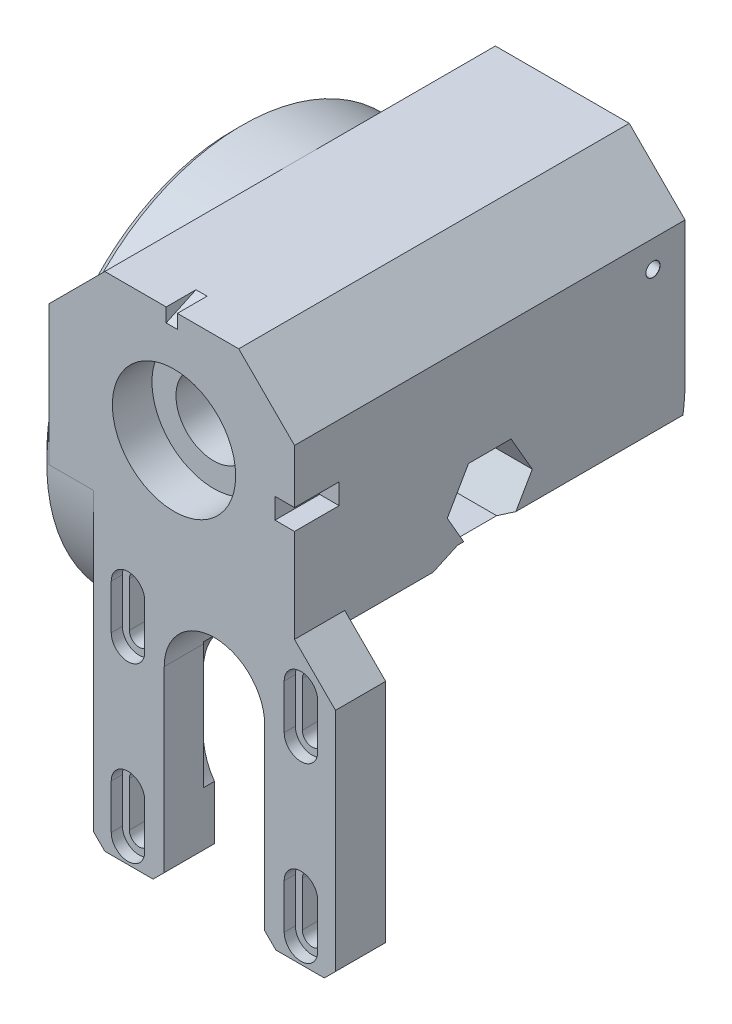
from build123d import *
from OCP.BRepFilletAPI import BRepFilletAPI_MakeChamfer

# Parameters (mm, degrees)
SKETCH1_R               = 35
SKETCH1_R_2             = 4
BOSS_EXTRUDE1_DEPTH     = 2
CHAMFER1_SIZE           = 1.6
SKETCH2_R               = 4
BOSS_EXTRUDE2_DEPTH     = 8
BOSS_EXTRUDE3_OUTLINE_R = 4
BOSS_EXTRUDE3_DEPTH     = 36
SKETCH18_R              = 4
CUT_EXTRUDE9_DEPTH      = 7
SKETCH_4_W              = 36
SKETCH_4_H              = 47
CUT_EXTRUDE_1_DEPTH     = 8
SKETCH_3_W              = 7.337713442
SKETCH_3_H              = 90
EXTRUDE_7_DEPTH         = 9
CUT_EXTRUDE_4_DEPTH     = 98.933200066
CUT_EXTRUDE_5_DEPTH     = 2
CHAMFER_1_SIZE          = 10
CHAMFER_2_SIZE          = 10
CHAMFER_4_SIZE          = 5
CHAMFER_4_SIZE2         = 2.886751346
CUT_EXTRUDE_13_REACH    = 105.778
SKETCH_16_R             = 6.75
CUT_EXTRUDE_15_DEPTH    = 12
CUT_EXTRUDE_21_DEPTH    = 2
SKETCH_39_R             = 11.05
SKETCH_39_R_2           = 6.75
CUT_EXTRUDE_29_DEPTH    = 18
SKETCH_40_W             = 1.391304348
SKETCH_40_H             = 0.391304348
CUT_EXTRUDE_30_DEPTH    = 1
CUT_EXTRUDE_START       = -7.1
SKETCH_12_R             = 11.05
SKETCH_12_R_2           = 4.5
CUT_EXTRUDE_36_DEPTH    = 7.1
CUT_EXTRUDE_37_DEPTH    = 104.778184968
CUT_EXTRUDE_39_DEPTH    = 98.933200066
CHAMFER_5_SIZE          = 2
SKETCH_48_W             = 8
SKETCH_48_H             = 1.85
CUT_EXTRUDE_46_DEPTH    = 3.5
CUT_EXTRUDE_48_DEPTH    = 1


# Read off the part's stored shape, not the designer's step: Boss-Extrude3, M3 螺纹孔的螺纹孔钻头1
with BuildPart() as part:
    # Sketch1 → Boss-Extrude1 (new body)
    with BuildSketch(Plane(origin=(0, 0, 0), x_dir=(0, 0, -1), z_dir=(1, 0, 0))):
        Circle(SKETCH1_R)
        Circle(SKETCH1_R_2, mode=Mode.SUBTRACT)
    extrude(amount=BOSS_EXTRUDE1_DEPTH)

    # Chamfer1
    chamfer1_edges = [part.edges().sort_by_distance(p)[0] for p in [
        (0, 0, 35),
    ]]
    chamfer(chamfer1_edges, length=CHAMFER1_SIZE)

    # Sketch2 → Boss-Extrude2 (add)
    with BuildSketch(Plane(origin=(2, 0, 0), x_dir=(0, 0, -1), z_dir=(1, 0, 0))):
        with BuildLine():
            Line((35, 35), (35, 0))
            ThreePointArc((35, 0), (0, -35), (-35, 0))
            Line((-35, 0), (-35, 35))
            Line((-35, 35), (35, 35))
        make_face()
        Circle(SKETCH2_R, mode=Mode.SUBTRACT)
    extrude(amount=BOSS_EXTRUDE2_DEPTH)

    # Boss-Extrude3 outline → Boss-Extrude3 (add)
    with BuildSketch(Plane(origin=(10, 0, 0), x_dir=(0, 0, -1), z_dir=(1, 0, 0))):
        with BuildLine():
            Line((35, 0), (35, 35))
            Line((35, 35), (-35, 35))
            Line((-35, 35), (-35, -55))
            Line((-35, -55), (-27, -55))
            Line((-27, -55), (-27, -10))
            Line((-27, -10), (-9.537637864, -10))
            Line((-9.537637864, -10), (-5.152968495, -8))
            Line((-5.152968495, -8), (34.073450075, -8))
            ThreePointArc((34.073450075, -8), (34.76759089, -4.026738592), (35, 0))
        make_face()
        Circle(BOSS_EXTRUDE3_OUTLINE_R, mode=Mode.SUBTRACT)
    extrude(amount=BOSS_EXTRUDE3_DEPTH)

    # Sketch18 → Cut-Extrude9 (cut)
    with BuildSketch(Plane.ZY):
        with Locations((14.142135624, 14.142135624)):
            Circle(SKETCH18_R)
        with Locations((14.142135624, -14.142135624)):
            Circle(SKETCH18_R)
        with Locations((-14.142135624, -14.142135624)):
            Circle(SKETCH18_R)
        with Locations((-14.142135624, 14.142135624)):
            Circle(SKETCH18_R)
    extrude(amount=-CUT_EXTRUDE9_DEPTH, mode=Mode.SUBTRACT)

    # 草图4 → 切除-拉伸1 (cut)
    with BuildSketch(Plane(origin=(0, 0, 27), x_dir=(-1, 0, 0), z_dir=(0, 0, -1))):
        with Locations((-28, -31.5)):
            Rectangle(SKETCH_4_W, SKETCH_4_H)
    extrude(amount=-CUT_EXTRUDE_1_DEPTH, mode=Mode.SUBTRACT)

    # 草图3 → 凸台-拉伸7 (add)
    with BuildSketch(Plane.XY.offset(35)):
        with Locations((49.668856721, -10)):
            Rectangle(SKETCH_3_W, SKETCH_3_H)
        Polygon((46, 35), (2, 35), (2, 0), (10, 0), (10, -55), (46, -55), align=None)
    extrude(amount=-EXTRUDE_7_DEPTH)

    # 草图7 → 切除-拉伸4 (cut, through all)
    with BuildSketch(Plane(origin=(0, 0, 26), x_dir=(-1, 0, 0), z_dir=(0, 0, -1))):
        with BuildLine():
            Line((-45.4, -12.5), (-45.4, -20.5))
            ThreePointArc((-45.4, -20.5), (-47.15, -22.25), (-48.9, -20.5))
            Line((-48.9, -20.5), (-48.9, -12.5))
            ThreePointArc((-48.9, -12.5), (-47.15, -10.75), (-45.4, -12.5))
        make_face()
        with BuildLine():
            Line((-14.4, -12.5), (-14.4, -20.5))
            ThreePointArc((-14.4, -20.5), (-16.15, -22.25), (-17.9, -20.5))
            Line((-17.9, -20.5), (-17.9, -12.5))
            ThreePointArc((-17.9, -12.5), (-16.15, -10.75), (-14.4, -12.5))
        make_face()
        with BuildLine():
            Line((-14.4, -43.5), (-14.4, -51.5))
            ThreePointArc((-14.4, -51.5), (-16.15, -53.25), (-17.9, -51.5))
            Line((-17.9, -51.5), (-17.9, -43.5))
            ThreePointArc((-17.9, -43.5), (-16.15, -41.75), (-14.4, -43.5))
        make_face()
        with BuildLine():
            Line((-45.4, -43.5), (-45.4, -51.5))
            ThreePointArc((-45.4, -51.5), (-47.15, -53.25), (-48.9, -51.5))
            Line((-48.9, -51.5), (-48.9, -43.5))
            ThreePointArc((-48.9, -43.5), (-47.15, -41.75), (-45.4, -43.5))
        make_face()
    extrude(amount=-CUT_EXTRUDE_4_DEPTH, mode=Mode.SUBTRACT)

    # 草图8 → 切除-拉伸5 (cut)
    with BuildSketch(Plane.XY.offset(35)):
        with BuildLine():
            Line((19.15, -12.5), (19.15, -20.5))
            ThreePointArc((19.15, -20.5), (16.15, -23.5), (13.15, -20.5))
            Line((13.15, -20.5), (13.15, -12.5))
            ThreePointArc((13.15, -12.5), (16.15, -9.5), (19.15, -12.5))
        make_face()
        with BuildLine():
            Line((50.15, -12.5), (50.15, -20.5))
            ThreePointArc((50.15, -20.5), (47.15, -23.5), (44.15, -20.5))
            Line((44.15, -20.5), (44.15, -12.5))
            ThreePointArc((44.15, -12.5), (47.15, -9.5), (50.15, -12.5))
        make_face()
        with BuildLine():
            Line((50.15, -43.5), (50.15, -51.5))
            ThreePointArc((50.15, -51.5), (47.15, -54.5), (44.15, -51.5))
            Line((44.15, -51.5), (44.15, -43.5))
            ThreePointArc((44.15, -43.5), (47.15, -40.5), (50.15, -43.5))
        make_face()
        with BuildLine():
            Line((19.15, -43.5), (19.15, -51.5))
            ThreePointArc((19.15, -51.5), (16.15, -54.5), (13.15, -51.5))
            Line((13.15, -51.5), (13.15, -43.5))
            ThreePointArc((13.15, -43.5), (16.15, -40.5), (19.15, -43.5))
        make_face()
    extrude(amount=-CUT_EXTRUDE_5_DEPTH, mode=Mode.SUBTRACT)

    # 倒角1
    chamfer_1_edges = [part.edges().sort_by_distance(p)[0] for p in [
        (46, 35, -4.5),
    ]]
    chamfer(chamfer_1_edges, length=CHAMFER_1_SIZE)

    # 倒角2
    # the kernel refuses this chamfer: 10 mm, written as the material it takes off along each edge
    with BuildSketch(Plane(origin=(2, 35, -6.3e-08), x_dir=(-0.02749587661058636, -0.9996219169112968, 0), z_dir=(0, 0, -1))) as chamfer_2_piece_1_section:
        Polygon((CHAMFER_2_SIZE * 0.999621916911, -CHAMFER_2_SIZE * 0.0274958766106), (-CHAMFER_2_SIZE * 0.0274958766106, -CHAMFER_2_SIZE * 0.999621916911), (0, 0), align=None)
    chamfer_2_piece_1 = extrude(amount=60.716829816, mode=Mode.PRIVATE)
    chamfer_2_piece_1 = chamfer_2_piece_1 - Plane(origin=(5.625203786, 0, 0), x_dir=(0, 0, -1), z_dir=(-1, 0, 0)) * Cylinder(35, 162, mode=Mode.PRIVATE)
    add(chamfer_2_piece_1, mode=Mode.SUBTRACT)
    with BuildSketch(Plane(origin=(2, 35, 60.71682988), x_dir=(-0.02749587661058636, -0.9996219169112968, 0), z_dir=(0, 0, -1))) as chamfer_2_piece_2_section:
        Polygon((CHAMFER_2_SIZE * 0.999621916911, -CHAMFER_2_SIZE * 0.0274958766106), (-CHAMFER_2_SIZE * 0.0274958766106, -CHAMFER_2_SIZE * 0.999621916911), (0, 0), align=None)
    chamfer_2_piece_2 = extrude(amount=60.716829943, mode=Mode.PRIVATE)
    chamfer_2_piece_2 = chamfer_2_piece_2 - Plane(origin=(5.625203786, 0, 0), x_dir=(0, 0, -1), z_dir=(-1, 0, 0)) * Cylinder(35, 162, mode=Mode.PRIVATE)
    add(chamfer_2_piece_2, mode=Mode.SUBTRACT)

    # 倒角4: one chamfer whose edges measure the first distance from different faces: ONE call of the kernel's chamfer builder (chamfer() names one face for all edges)
    chamfer_4_edges_1 = [part.edges().sort_by_distance(p)[0] for p in [
        (46, -9, 7.34530318),
    ]]
    chamfer_4_side_1 = [part.faces().sort_by_distance(p)[0] for p in [
        (28, -9, 7.34530318),
    ]]
    chamfer_4_edges_2 = [part.edges().sort_by_distance(p)[0] for p in [
        (46, -8, -14.46024079),
    ]]
    chamfer_4_side_2 = [part.faces().sort_by_distance(p)[0] for p in [
        (28, -8, -14.46024079),
    ]]
    chamfer_4_edges_3 = [part.edges().sort_by_distance(p)[0] for p in [
        (46, -10, 17.768818932),
    ]]
    chamfer_4_side_3 = [part.faces().sort_by_distance(p)[0] for p in [
        (28, -10, 17.768818932),
    ]]
    chamfer_4 = BRepFilletAPI_MakeChamfer(part.part.solid().wrapped)
    for e in chamfer_4_edges_1:
        chamfer_4.Add(CHAMFER_4_SIZE, CHAMFER_4_SIZE2, e.wrapped, chamfer_4_side_1[0].wrapped)  # the first distance lies on this face
    for e in chamfer_4_edges_2:
        chamfer_4.Add(CHAMFER_4_SIZE, CHAMFER_4_SIZE2, e.wrapped, chamfer_4_side_2[0].wrapped)  # the first distance lies on this face
    for e in chamfer_4_edges_3:
        chamfer_4.Add(CHAMFER_4_SIZE, CHAMFER_4_SIZE2, e.wrapped, chamfer_4_side_3[0].wrapped)  # the first distance lies on this face
    add(Compound.cast(chamfer_4.Shape()), mode=Mode.REPLACE)

    # 草图16 → 切除-拉伸13 (cut, up to next)
    with BuildSketch(Plane(origin=(0, 0, -35), x_dir=(-1, 0, 0), z_dir=(0, 0, -1)), mode=Mode.PRIVATE) as cut_extrude_13_sk1:
        with Locations(Location((-24.4, 15, 0), (0, 0, 90))):
            Circle(SKETCH_16_R)
    cut_extrude_13_tool1 = extrude(cut_extrude_13_sk1.sketch, amount=-CUT_EXTRUDE_13_REACH, mode=Mode.PRIVATE) & part.part
    add(cut_extrude_13_tool1.solids().sort_by_distance((24.4, 15, -35))[0], mode=Mode.SUBTRACT)

    # 草图19 → 切除-拉伸15 (cut)
    with BuildSketch(Plane(origin=(46, 0, 0), x_dir=(0, 0, -1), z_dir=(1, 0, 0))):
        Polygon((3.810511777, -6.6), (7.621023553, 0), (3.810511777, 6.6), (-3.810511777, 6.6), (-7.621023553, 0), (-3.810511777, -6.6), align=None)
    extrude(amount=-CUT_EXTRUDE_15_DEPTH, mode=Mode.SUBTRACT)

    # 草图27 → 切除-拉伸21 (cut)
    with BuildSketch(Plane.XY.offset(26)):
        with BuildLine():
            Line((20.65, -37), (20.65, -27))
            ThreePointArc((20.65, -27), (31.65, -16), (42.65, -27))
            Line((42.65, -27), (42.65, -37))
            ThreePointArc((42.65, -37), (31.65, -48), (20.65, -37))
        make_face()
    extrude(amount=CUT_EXTRUDE_21_DEPTH, mode=Mode.SUBTRACT)

    # 草图39 → 切除-拉伸29 (cut)
    with BuildSketch(Plane(origin=(0, 0, -35), x_dir=(-1, 0, 0), z_dir=(0, 0, -1))):
        with Locations(Location((-24.4, 15, 0), (0, 0, 90))):
            Circle(SKETCH_39_R)
        with Locations(Location((-24.4, 15, 0), (0, 0, 90))):
            Circle(SKETCH_39_R_2, mode=Mode.SUBTRACT)
    extrude(amount=-CUT_EXTRUDE_29_DEPTH, mode=Mode.SUBTRACT)

    # 草图40 → 切除-拉伸30 (cut)
    # profile 1 of 11: a face of its own
    with BuildSketch(Plane.XZ.offset(8)):
        Polygon((16.851317631, -15.470025994), (16.406344805, -15.470025994), (16.205257848, -14.817852081), (14.959333935, -14.817852081), (14.753491544, -15.470025994), (14.3295785, -15.470025994), (15.326861109, -12.470025994), (15.88596437, -12.470025994), align=None)
        Polygon((16.09860024, -14.470025994), (15.590448066, -12.819890125), (15.069388283, -14.470025994), align=None, mode=Mode.SUBTRACT)
    # profile 2 of 11: a face of its own
    with BuildSketch(Plane.XZ.offset(8)):
        Polygon((19.394795892, -15.470025994), (18.879170892, -15.470025994), (18.153627413, -14.309699907), (17.425366544, -15.470025994), (16.916535022, -15.470025994), (17.909741544, -13.919074907), (17.003491544, -12.470025994), (17.487187196, -12.470025994), (18.159741544, -13.529129255), (18.837730674, -12.470025994), (19.30783937, -12.470025994), (18.402948066, -13.912281429), align=None)
    # profile 3 of 11: a face of its own
    with BuildSketch(Plane.XZ.offset(8)):
        Polygon((20.525230674, -12.817852081), (19.8295785, -12.817852081), (19.8295785, -12.470025994), (21.655665457, -12.470025994), (21.655665457, -12.817852081), (20.960013283, -12.817852081), (20.960013283, -15.122199907), (21.655665457, -15.122199907), (21.655665457, -15.470025994), (19.8295785, -15.470025994), (19.8295785, -15.122199907), (20.525230674, -15.122199907), align=None)
    # profile 4 of 11: a face of its own
    with BuildSketch(Plane.XZ.offset(8)):
        with BuildLine():
            add(Edge.make_bspline(
                [(24.30783937, -14.658205342), (24.306863056, -14.692918378), (24.304969024, -14.760261083), (24.288304827, -14.858252502), (24.260514205, -14.949271679), (24.222325464, -15.033941656), (24.173198352, -15.110724697), (24.117084071, -15.182391478), (24.05007892, -15.245429885), (23.975848413, -15.3028293), (23.893233107, -15.353344765), (23.802021603, -15.395858147), (23.703464294, -15.43258587), (23.597287356, -15.462199527), (23.484440168, -15.485220142), (23.365479745, -15.501034546), (23.241003768, -15.511708169), (23.156141539, -15.512897674), (23.112866544, -15.513504255)],
                knots=[0, 0, 0, 0, 1.005643061, 1.95093061, 2.870738502, 3.757832008, 4.633806625, 5.507195241, 6.389247641, 7.292512577, 8.223494331, 9.189475669, 10.205094408, 11.269007441, 12.381228937, 13.540657028, 14.745872513, 16, 16, 16, 16], degree=3))
            add(Edge.make_bspline(
                [(23.112866544, -15.513504255), (23.073006042, -15.513057638), (22.993475888, -15.512166543), (22.875208029, -15.506703737), (22.759503923, -15.497679378), (22.648092539, -15.486827646), (22.54181823, -15.474764532), (22.442088904, -15.460813278), (22.350162525, -15.444591247), (22.291959437, -15.432351493), (22.264361109, -15.426547733)],
                knots=[0, 0, 0, 0, 1.119729043, 2.234096861, 3.324996266, 4.379512959, 5.378439906, 6.329323539, 7.207810484, 8, 8, 8, 8], degree=3))
            Line((22.264361109, -15.426547733), (22.264361109, -15.035243385))
            add(Edge.make_bspline(
                [(22.264361109, -15.035243385), (22.293908648, -15.04536727), (22.354281712, -15.066052915), (22.448982488, -15.0903153), (22.548320499, -15.113101429), (22.653239689, -15.132137822), (22.764762226, -15.147120395), (22.883313604, -15.157657457), (23.009292073, -15.16479307), (23.095645905, -15.16537764), (23.140040457, -15.165678168)],
                knots=[0, 0, 0, 0, 0.842364813, 1.72116351, 2.635659137, 3.591954833, 4.596841017, 5.670471508, 6.802388115, 8, 8, 8, 8], degree=3))
            add(Edge.make_bspline(
                [(23.140040457, -15.165678168), (23.171758228, -15.165351663), (23.232765976, -15.164723645), (23.320675035, -15.158157863), (23.40140017, -15.149597744), (23.47476748, -15.134729529), (23.541513295, -15.117616091), (23.601843101, -15.095838646), (23.655661714, -15.06992222), (23.703907991, -15.040868741), (23.745256104, -15.007300048), (23.781507465, -14.971123095), (23.810599296, -14.930765956), (23.83423081, -14.887186379), (23.85170034, -14.840236986), (23.863831835, -14.790041746), (23.871463305, -14.736788927), (23.872516232, -14.700124929), (23.873056761, -14.681303168)],
                knots=[0, 0, 0, 0, 1.523194236, 2.929797672, 4.233142745, 5.41923506, 6.522104548, 7.540643951, 8.494207191, 9.387815665, 10.238903194, 11.04655015, 11.840679357, 12.619387111, 13.4214478, 14.239285369, 15.096122854, 16, 16, 16, 16], degree=3))
            add(Edge.make_bspline(
                [(23.873056761, -14.681303168), (23.872382194, -14.661746383), (23.87106423, -14.623536538), (23.857602133, -14.56871879), (23.836554238, -14.517883978), (23.805696955, -14.472546922), (23.769434308, -14.429948904), (23.72683396, -14.390915573), (23.67980914, -14.353171158), (23.608456303, -14.305705876), (23.508613888, -14.249932271), (23.375612488, -14.194157789), (23.234572648, -14.138156835), (23.089827868, -14.07974756), (22.945119991, -14.017745884), (22.803155865, -13.952061731), (22.670009755, -13.876708371), (22.569748366, -13.801937644), (22.499698524, -13.734609031), (22.452042617, -13.68069959), (22.411151803, -13.621830932), (22.373377868, -13.560085059), (22.343825048, -13.491849179), (22.32332124, -13.417764497), (22.309714193, -13.337821728), (22.308478838, -13.28258572), (22.30783937, -13.253993385)],
                knots=[0, 0, 0, 0, 0.619815692, 1.2109895, 1.781199776, 2.357496674, 2.943929778, 3.554333405, 4.188738872, 4.856760597, 6.272963823, 7.811824644, 9.431291666, 11.092170587, 12.76691914, 14.429617761, 16.056218893, 17.616396577, 18.384212937, 19.138341755, 19.896401647, 20.65718422, 21.4332038, 22.247956952, 23.09307348, 24, 24, 24, 24], degree=3))
            add(Edge.make_bspline(
                [(22.30783937, -13.253993385), (22.308618811, -13.228355328), (22.310179609, -13.177016221), (22.323072766, -13.10030347), (22.343350422, -13.024261003), (22.371898039, -12.949165399), (22.409291803, -12.876754666), (22.454800989, -12.80733491), (22.510700058, -12.74341942), (22.574797876, -12.68315226), (22.648953544, -12.628011981), (22.732240238, -12.577711606), (22.826012929, -12.534544289), (22.92847657, -12.49537107), (23.041696822, -12.464275691), (23.165112334, -12.441998211), (23.298747257, -12.429424954), (23.391146429, -12.427528799), (23.4389535, -12.426547733)],
                knots=[0, 0, 0, 0, 0.784067079, 1.570060577, 2.373452904, 3.189297991, 4.022898002, 4.862695015, 5.722463422, 6.614650011, 7.550049647, 8.544652583, 9.586108202, 10.704431291, 11.897970904, 13.172772987, 14.537200697, 16, 16, 16, 16], degree=3))
            add(Edge.make_bspline(
                [(23.4389535, -12.426547733), (23.46568462, -12.426720922), (23.521238556, -12.427080852), (23.606837457, -12.433234354), (23.696118255, -12.440995092), (23.786902719, -12.452112417), (23.877535523, -12.464804209), (23.966513649, -12.479767691), (24.051928816, -12.495738251), (24.107230394, -12.507720177), (24.133926327, -12.513504255)],
                knots=[0, 0, 0, 0, 0.91416123, 1.89985515, 2.934260182, 3.979599391, 5.027947684, 6.064525625, 7.065681407, 8, 8, 8, 8], degree=3))
            Line((24.133926327, -12.513504255), (24.133926327, -12.861330342))
            add(Edge.make_bspline(
                [(24.133926327, -12.861330342), (24.074505843, -12.848151272), (23.956254233, -12.821923849), (23.778285423, -12.795760711), (23.603509818, -12.777438165), (23.488138107, -12.775383056), (23.431480674, -12.77437382)],
                knots=[0, 0, 0, 0, 1.029411825, 2.048613503, 3.041701399, 4, 4, 4, 4], degree=3))
            add(Edge.make_bspline(
                [(23.431480674, -12.77437382), (23.402940955, -12.774810058), (23.347619797, -12.775655658), (23.267529963, -12.780854671), (23.193372842, -12.790375035), (23.125073091, -12.803251294), (23.06244196, -12.819185855), (23.005672202, -12.839430021), (22.955076577, -12.864140695), (22.909803794, -12.891904699), (22.870518544, -12.923334997), (22.835983581, -12.95670232), (22.807150642, -12.992985651), (22.783876345, -13.032178521), (22.765662349, -13.07375984), (22.751516946, -13.117555729), (22.744337616, -13.164309619), (22.743202518, -13.196228468), (22.742621979, -13.212553168)],
                knots=[0, 0, 0, 0, 1.491437277, 2.890989782, 4.191431573, 5.395946596, 6.521058188, 7.565423013, 8.539223212, 9.458660202, 10.334655275, 11.163081303, 11.963306063, 12.748694206, 13.538083787, 14.331542868, 15.146677777, 16, 16, 16, 16], degree=3))
            add(Edge.make_bspline(
                [(22.742621979, -13.212553168), (22.743295788, -13.232108042), (22.74461227, -13.270314152), (22.75813507, -13.325362577), (22.779295496, -13.376340333), (22.808880633, -13.423092486), (22.846567825, -13.464760535), (22.888047711, -13.505292423), (22.935239056, -13.54331736), (23.006452042, -13.592003875), (23.107175365, -13.647486905), (23.239524865, -13.705698887), (23.381346862, -13.760104034), (23.525749917, -13.819086112), (23.670977353, -13.880442774), (23.789337813, -13.937521994), (23.881197491, -13.986519848), (23.945571809, -14.027594886), (24.00669543, -14.07091568), (24.062898664, -14.118775796), (24.115641569, -14.16939539), (24.16278949, -14.225035609), (24.20484726, -14.284484802), (24.241111754, -14.348341018), (24.272129954, -14.41673401), (24.292357091, -14.49197918), (24.305969926, -14.573018591), (24.307201927, -14.629158379), (24.30783937, -14.658205342)],
                knots=[0, 0, 0, 0, 0.667485538, 1.304126353, 1.925325377, 2.548259058, 3.18485279, 3.841928735, 4.529978862, 5.253739616, 6.789399884, 8.452896455, 10.194043647, 11.982660287, 13.786213269, 15.583473082, 16.473910229, 17.343881083, 18.192645259, 19.033319022, 19.865571682, 20.689426309, 21.522902605, 22.351690537, 23.197589349, 24.082454772, 25.007853999, 26, 26, 26, 26], degree=3))
        make_face()
    # profile 5 of 11: a face of its own
    with BuildSketch(Plane.XZ.offset(8)):
        with Locations((25.873056761, -14.230895559)):
            Rectangle(SKETCH_40_W, SKETCH_40_H)
    # profile 6 of 11: a face of its own
    with BuildSketch(Plane.XZ.offset(8)):
        with BuildLine():
            add(Edge.make_bspline(
                [(29.438274153, -14.546792298), (29.437119323, -14.579676347), (29.43482966, -14.64487505), (29.419873205, -14.741189858), (29.39356996, -14.834221911), (29.357879169, -14.924023007), (29.311074612, -15.009168091), (29.255550324, -15.090157745), (29.187970477, -15.164276213), (29.111162563, -15.233313275), (29.023252484, -15.295040246), (28.925796112, -15.351241605), (28.816923475, -15.399094188), (28.697984398, -15.440482322), (28.568832533, -15.474013409), (28.429160059, -15.496350945), (28.279621919, -15.511058635), (28.176310061, -15.512672414), (28.123056761, -15.513504255)],
                knots=[0, 0, 0, 0, 0.861844565, 1.708766071, 2.546803722, 3.390976017, 4.235482026, 5.088267806, 5.958166408, 6.857625573, 7.789680516, 8.767975323, 9.801402493, 10.901266619, 12.065759824, 13.293144602, 14.604719897, 16, 16, 16, 16], degree=3))
            add(Edge.make_bspline(
                [(28.123056761, -15.513504255), (28.065527505, -15.5128124), (27.95651004, -15.51150134), (27.800773899, -15.502841427), (27.659060635, -15.488003996), (27.568908861, -15.475893488), (27.525230674, -15.470025994)],
                knots=[0, 0, 0, 0, 1.150713897, 2.180593327, 3.118504498, 4, 4, 4, 4], degree=3))
            Line((27.525230674, -15.470025994), (27.525230674, -15.122199907))
            add(Edge.make_bspline(
                [(27.525230674, -15.122199907), (27.574561284, -15.128613679), (27.675534512, -15.14174182), (27.830928352, -15.156086406), (27.992083168, -15.16407013), (28.101309229, -15.165139398), (28.156344805, -15.165678168)],
                knots=[0, 0, 0, 0, 0.942811003, 1.929809335, 2.956896058, 4, 4, 4, 4], degree=3))
            add(Edge.make_bspline(
                [(28.156344805, -15.165678168), (28.192813652, -15.165115385), (28.263340416, -15.164027024), (28.364792766, -15.15691341), (28.458023061, -15.143892916), (28.543192531, -15.126419746), (28.620814952, -15.104332603), (28.690834929, -15.076944977), (28.753403926, -15.045389786), (28.80840583, -15.008922751), (28.856669154, -14.968709986), (28.897447063, -14.923804447), (28.931302988, -14.874928849), (28.957929782, -14.821997506), (28.978079133, -14.765284323), (28.993243438, -14.705059973), (29.002111115, -14.641261085), (29.003026363, -14.597544288), (29.003491544, -14.575324907)],
                knots=[0, 0, 0, 0, 1.490140128, 2.881768065, 4.152352525, 5.333691038, 6.431800578, 7.445549096, 8.401444764, 9.289364022, 10.136425943, 10.961731228, 11.759931868, 12.558561418, 13.375159002, 14.214453508, 15.092482988, 16, 16, 16, 16], degree=3))
            add(Edge.make_bspline(
                [(29.003491544, -14.575324907), (29.002859592, -14.555131889), (29.001629689, -14.515832251), (28.991475576, -14.458773509), (28.973465276, -14.406183904), (28.949686345, -14.357389953), (28.919201313, -14.313032179), (28.883851052, -14.271765225), (28.841993338, -14.235120588), (28.794655719, -14.20236668), (28.742297761, -14.173617548), (28.685694098, -14.147078807), (28.623430585, -14.126730679), (28.557055114, -14.108814036), (28.486559632, -14.095819136), (28.412748653, -14.085051388), (28.335533832, -14.08011646), (28.282934169, -14.079191571), (28.256208935, -14.078721646)],
                knots=[0, 0, 0, 0, 0.962645216, 1.873499504, 2.751163712, 3.60600831, 4.45366029, 5.311093063, 6.190880762, 7.098592726, 8.05100711, 9.036815858, 10.075001357, 11.16993685, 12.313633837, 13.491143935, 14.725281481, 16, 16, 16, 16], degree=3))
            Line((28.256208935, -14.078721646), (27.916535022, -14.078721646))
            Line((27.916535022, -14.078721646), (27.916535022, -13.730895559))
            Line((27.916535022, -13.730895559), (28.266399153, -13.730895559))
            add(Edge.make_bspline(
                [(28.266399153, -13.730895559), (28.288610651, -13.730579472), (28.332237243, -13.72995863), (28.39601814, -13.722867889), (28.456874447, -13.712076127), (28.514608009, -13.697212782), (28.569029359, -13.678354539), (28.619260108, -13.655292811), (28.665515877, -13.628522921), (28.707470218, -13.59786601), (28.746080983, -13.564237511), (28.778562654, -13.525430474), (28.807658222, -13.483921102), (28.83115292, -13.438094221), (28.850701366, -13.38913811), (28.863020258, -13.336207796), (28.871634837, -13.280543438), (28.872576804, -13.24225327), (28.873056761, -13.222743385)],
                knots=[0, 0, 0, 0, 1.192823995, 2.342878639, 3.443008352, 4.511191983, 5.54236148, 6.533123054, 7.476280357, 8.408308338, 9.321648148, 10.218966078, 11.119987697, 12.039625921, 12.979481888, 13.944359475, 14.9525951, 16, 16, 16, 16], degree=3))
            add(Edge.make_bspline(
                [(28.873056761, -13.222743385), (28.872812152, -13.203917314), (28.872335546, -13.167235867), (28.864458811, -13.114514539), (28.853104802, -13.065477056), (28.836855546, -13.020458732), (28.815706134, -12.979288368), (28.789662567, -12.9422392), (28.758818592, -12.909262599), (28.723013028, -12.880806478), (28.683248696, -12.855379381), (28.638776566, -12.833600769), (28.589843154, -12.815838151), (28.537012511, -12.799487237), (28.479548653, -12.788590041), (28.417838472, -12.780582095), (28.351881703, -12.77470122), (28.306268079, -12.774485344), (28.2827035, -12.77437382)],
                knots=[0, 0, 0, 0, 1.064287749, 2.073699511, 3.009236736, 3.9091673, 4.774588449, 5.620725501, 6.46384913, 7.320401755, 8.201989857, 9.130391188, 10.115765889, 11.145550715, 12.256343534, 13.419843727, 14.667058473, 16, 16, 16, 16], degree=3))
            add(Edge.make_bspline(
                [(28.2827035, -12.77437382), (28.230305598, -12.776006367), (28.123157416, -12.779344753), (27.988882975, -12.800804204), (27.878557719, -12.825051463), (27.792242046, -12.847582258), (27.702982478, -12.874134861), (27.642922117, -12.894425299), (27.612187196, -12.904808603)],
                knots=[0, 0, 0, 0, 1.374009053, 2.809703548, 3.557729416, 4.33717134, 5.149074242, 6, 6, 6, 6], degree=3))
            Line((27.612187196, -12.904808603), (27.612187196, -12.556982516))
            add(Edge.make_bspline(
                [(27.612187196, -12.556982516), (27.639708631, -12.546927531), (27.69584175, -12.526419238), (27.783127746, -12.501282834), (27.872601909, -12.4788809), (27.963123699, -12.460773857), (28.053246958, -12.445578659), (28.142572257, -12.434949253), (28.229818812, -12.427622812), (28.287218376, -12.426901013), (28.315312196, -12.426547733)],
                knots=[0, 0, 0, 0, 0.978322217, 1.995400233, 3.031781794, 4.058180853, 5.077730371, 6.083355555, 7.06191161, 8, 8, 8, 8], degree=3))
            add(Edge.make_bspline(
                [(28.315312196, -12.426547733), (28.354962606, -12.427194822), (28.431665393, -12.428446599), (28.543052837, -12.438205178), (28.647132665, -12.453315394), (28.743920265, -12.475684244), (28.832981168, -12.504452398), (28.915235543, -12.53732085), (28.989464657, -12.576751837), (29.056024417, -12.621823042), (29.114691839, -12.672341292), (29.166272929, -12.727722532), (29.209968886, -12.788381057), (29.245485156, -12.854268555), (29.273234275, -12.924558005), (29.294086497, -12.999124148), (29.30536473, -13.07837611), (29.307003291, -13.132583802), (29.30783937, -13.160243385)],
                knots=[0, 0, 0, 0, 1.364346343, 2.639295939, 3.84503498, 4.981142705, 6.053223054, 7.063352329, 8.025569508, 8.939887992, 9.824051135, 10.684331437, 11.538625567, 12.389464824, 13.253408307, 14.134440564, 15.048094572, 16, 16, 16, 16], degree=3))
            add(Edge.make_bspline(
                [(29.30783937, -13.160243385), (29.306457789, -13.200924977), (29.303781493, -13.279730324), (29.277794303, -13.392910572), (29.235921965, -13.496336399), (29.175272352, -13.5882385), (29.101057638, -13.670148255), (29.014336932, -13.743049187), (28.916148454, -13.80873693), (28.843235151, -13.842590937), (28.805801327, -13.859971646)],
                knots=[0, 0, 0, 0, 1.062433809, 2.058067584, 3.019272504, 3.965418163, 4.921501302, 5.900439357, 6.922081703, 8, 8, 8, 8], degree=3))
            add(Edge.make_bspline(
                [(28.805801327, -13.859971646), (28.844682232, -13.867967259), (28.923532393, -13.884182296), (29.036054671, -13.932948302), (29.14315471, -13.99543206), (29.222956661, -14.062603978), (29.28019794, -14.122984979), (29.318730955, -14.172807735), (29.353993636, -14.226025445), (29.38356907, -14.283733341), (29.408252476, -14.344742991), (29.42613191, -14.409171411), (29.436377499, -14.476940122), (29.437633754, -14.523206952), (29.438274153, -14.546792298)],
                knots=[0, 0, 0, 0, 1.405413986, 2.85016813, 4.327699737, 5.794019892, 6.533135325, 7.277475483, 8.026443619, 8.795662385, 9.574684764, 10.358501172, 11.163216512, 12, 12, 12, 12], degree=3))
        make_face()
    # profile 7 of 11: a face of its own
    with BuildSketch(Plane.XZ.offset(8)):
        with BuildLine():
            Line((16.612187196, -21.948286864), (14.655665457, -21.948286864))
            Line((14.655665457, -21.948286864), (14.655665457, -21.579400994))
            Line((14.655665457, -21.579400994), (15.41110024, -20.815814038))
            add(Edge.make_bspline(
                [(15.41110024, -20.815814038), (15.440556958, -20.785715819), (15.497010388, -20.728032964), (15.577732175, -20.644948477), (15.648206773, -20.566423935), (15.711210824, -20.49417974), (15.767040536, -20.426622463), (15.815026853, -20.361883358), (15.857766782, -20.3009756), (15.892928808, -20.242065872), (15.923771409, -20.186024715), (15.947494443, -20.131124893), (15.968392035, -20.078531695), (15.985836871, -20.008579417), (16.000831577, -19.918575268), (16.002588239, -19.845327222), (16.003491544, -19.807661864)],
                knots=[0, 0, 0, 0, 1.467801241, 2.813022554, 4.036721291, 5.144444768, 6.153968288, 7.089984895, 7.95251278, 8.745669366, 9.480110839, 10.179673505, 10.829044045, 11.449272791, 12.688373796, 14, 14, 14, 14], degree=3))
            add(Edge.make_bspline(
                [(16.003491544, -19.807661864), (16.002075046, -19.771313995), (15.999286615, -19.699761827), (15.980334264, -19.61268147), (15.959046358, -19.546663661), (15.937737713, -19.500719657), (15.913197886, -19.457369112), (15.88460722, -19.417235326), (15.852218453, -19.380339937), (15.814627506, -19.347870907), (15.77273254, -19.319500151), (15.726008209, -19.295465736), (15.674648402, -19.276582058), (15.618754582, -19.26207777), (15.557842057, -19.254119628), (15.515741748, -19.25314069), (15.493980674, -19.25263469)],
                knots=[0, 0, 0, 0, 1.786063733, 3.515934619, 4.361143923, 5.193414643, 6.001490655, 6.8080304, 7.612645686, 8.409905662, 9.243888339, 10.095602441, 10.987157488, 11.929830611, 12.929957752, 14, 14, 14, 14], degree=3))
            add(Edge.make_bspline(
                [(15.493980674, -19.25263469), (15.4635718, -19.253717051), (15.403479906, -19.255855937), (15.315497231, -19.271695615), (15.231604911, -19.298292956), (15.15279022, -19.33627899), (15.07803922, -19.382453694), (15.005921735, -19.434013823), (14.936670006, -19.491984738), (14.894008183, -19.535114492), (14.872377413, -19.556982516)],
                knots=[0, 0, 0, 0, 1.023997976, 2.023553336, 3.000587663, 3.979882544, 4.962380846, 5.957326575, 6.964305914, 8, 8, 8, 8], degree=3))
            Line((14.872377413, -19.556982516), (14.655665457, -19.295433603))
            add(Edge.make_bspline(
                [(14.655665457, -19.295433603), (14.684115356, -19.266770632), (14.740837686, -19.209623489), (14.835327034, -19.134475288), (14.935523141, -19.067631602), (15.042034988, -19.009075943), (15.156721266, -18.961517908), (15.280731974, -18.928547703), (15.413395909, -18.908600302), (15.504778361, -18.906095448), (15.55172524, -18.904808603)],
                knots=[0, 0, 0, 0, 0.961904287, 1.917808245, 2.871393154, 3.830279184, 4.810558542, 5.822670133, 6.881417188, 8, 8, 8, 8], degree=3))
            add(Edge.make_bspline(
                [(15.55172524, -18.904808603), (15.583925139, -18.905290462), (15.646960272, -18.906233758), (15.739115498, -18.918644334), (15.827354571, -18.93629082), (15.910571717, -18.963169779), (15.989361564, -18.99578751), (16.062837489, -19.034774584), (16.130085364, -19.081846009), (16.191898018, -19.13470945), (16.248219748, -19.193998851), (16.296969322, -19.260563773), (16.340279443, -19.332571823), (16.375133577, -19.41128379), (16.404381803, -19.494882068), (16.423258996, -19.584406181), (16.436170889, -19.678662796), (16.437561764, -19.743303614), (16.438274153, -19.776411864)],
                knots=[0, 0, 0, 0, 1.101119101, 2.155571603, 3.176926796, 4.176889981, 5.142604225, 6.092612713, 7.016989052, 7.945805093, 8.872290513, 9.808448578, 10.764035296, 11.742108021, 12.749341803, 13.789111775, 14.867609617, 16, 16, 16, 16], degree=3))
            add(Edge.make_bspline(
                [(16.438274153, -19.776411864), (16.437748739, -19.804508777), (16.436712591, -19.85991766), (16.428622894, -19.941504676), (16.414250051, -20.019813209), (16.394472934, -20.095221198), (16.368629525, -20.168756139), (16.338477415, -20.242141076), (16.301233865, -20.314865547), (16.259049474, -20.388033245), (16.210254036, -20.461231851), (16.1569405, -20.536448773), (16.095687833, -20.611433937), (16.030001903, -20.689303578), (15.957125907, -20.768522739), (15.880017213, -20.852606197), (15.795435672, -20.939275231), (15.736786777, -20.998158901), (15.706616544, -21.028449907)],
                knots=[0, 0, 0, 0, 0.902990484, 1.780754108, 2.631610674, 3.459590136, 4.283625367, 5.135197631, 6.007543003, 6.907624824, 7.848341594, 8.83404703, 9.869576246, 10.959028296, 12.108116138, 13.328740157, 14.625847426, 16, 16, 16, 16], degree=3))
            Line((15.706616544, -21.028449907), (15.177404587, -21.556982516))
            Line((15.177404587, -21.556982516), (16.612187196, -21.556982516))
            Line((16.612187196, -21.556982516), (16.612187196, -21.948286864))
        make_face()
    # profile 8 of 11: a face of its own
    with BuildSketch(Plane.XZ.offset(8)):
        with Locations((18.177404587, -20.709156429)):
            Rectangle(SKETCH_40_W, SKETCH_40_H)
    # profile 9 of 11: a face of its own
    with BuildSketch(Plane.XZ.offset(8)):
        with BuildLine():
            Line((21.742621979, -21.948286864), (19.78610024, -21.948286864))
            Line((19.78610024, -21.948286864), (19.78610024, -21.579400994))
            Line((19.78610024, -21.579400994), (20.541535022, -20.815814038))
            add(Edge.make_bspline(
                [(20.541535022, -20.815814038), (20.570991741, -20.785715819), (20.627445171, -20.728032964), (20.708166958, -20.644948477), (20.778641556, -20.566423935), (20.841645607, -20.49417974), (20.897475318, -20.426622463), (20.945461636, -20.361883358), (20.988201564, -20.3009756), (21.02336359, -20.242065872), (21.054206191, -20.186024715), (21.077929225, -20.131124893), (21.098826818, -20.078531695), (21.116271654, -20.008579417), (21.13126636, -19.918575268), (21.133023022, -19.845327222), (21.133926327, -19.807661864)],
                knots=[0, 0, 0, 0, 1.467801241, 2.813022554, 4.036721291, 5.144444768, 6.153968288, 7.089984895, 7.95251278, 8.745669366, 9.480110839, 10.179673505, 10.829044045, 11.449272791, 12.688373796, 14, 14, 14, 14], degree=3))
            add(Edge.make_bspline(
                [(21.133926327, -19.807661864), (21.132509828, -19.771313995), (21.129721398, -19.699761827), (21.110769047, -19.61268147), (21.08948114, -19.546663661), (21.068172495, -19.500719657), (21.043632669, -19.457369112), (21.015042003, -19.417235326), (20.982653235, -19.380339937), (20.945062288, -19.347870907), (20.903167322, -19.319500151), (20.856442992, -19.295465736), (20.805083184, -19.276582058), (20.749189364, -19.26207777), (20.68827684, -19.254119628), (20.646176531, -19.25314069), (20.624415457, -19.25263469)],
                knots=[0, 0, 0, 0, 1.786063733, 3.515934619, 4.361143923, 5.193414643, 6.001490655, 6.8080304, 7.612645686, 8.409905662, 9.243888339, 10.095602441, 10.987157488, 11.929830611, 12.929957752, 14, 14, 14, 14], degree=3))
            add(Edge.make_bspline(
                [(20.624415457, -19.25263469), (20.594006583, -19.253717051), (20.533914689, -19.255855937), (20.445932013, -19.271695615), (20.362039693, -19.298292956), (20.283225002, -19.33627899), (20.208474003, -19.382453694), (20.136356518, -19.434013823), (20.067104788, -19.491984738), (20.024442965, -19.535114492), (20.002812196, -19.556982516)],
                knots=[0, 0, 0, 0, 1.023997976, 2.023553336, 3.000587663, 3.979882544, 4.962380846, 5.957326575, 6.964305914, 8, 8, 8, 8], degree=3))
            Line((20.002812196, -19.556982516), (19.78610024, -19.295433603))
            add(Edge.make_bspline(
                [(19.78610024, -19.295433603), (19.814550139, -19.266770632), (19.871272468, -19.209623489), (19.965761817, -19.134475288), (20.065957924, -19.067631602), (20.172469771, -19.009075943), (20.287156049, -18.961517908), (20.411166757, -18.928547703), (20.543830691, -18.908600302), (20.635213144, -18.906095448), (20.682160022, -18.904808603)],
                knots=[0, 0, 0, 0, 0.961904287, 1.917808245, 2.871393154, 3.830279184, 4.810558542, 5.822670133, 6.881417188, 8, 8, 8, 8], degree=3))
            add(Edge.make_bspline(
                [(20.682160022, -18.904808603), (20.714359922, -18.905290462), (20.777395054, -18.906233758), (20.86955028, -18.918644334), (20.957789354, -18.93629082), (21.041006499, -18.963169779), (21.119796346, -18.99578751), (21.193272272, -19.034774584), (21.260520147, -19.081846009), (21.3223328, -19.13470945), (21.37865453, -19.193998851), (21.427404105, -19.260563773), (21.470714225, -19.332571823), (21.50556836, -19.41128379), (21.534816586, -19.494882068), (21.553693779, -19.584406181), (21.566605672, -19.678662796), (21.567996546, -19.743303614), (21.568708935, -19.776411864)],
                knots=[0, 0, 0, 0, 1.101119101, 2.155571603, 3.176926796, 4.176889981, 5.142604225, 6.092612713, 7.016989052, 7.945805093, 8.872290513, 9.808448578, 10.764035296, 11.742108021, 12.749341803, 13.789111775, 14.867609617, 16, 16, 16, 16], degree=3))
            add(Edge.make_bspline(
                [(21.568708935, -19.776411864), (21.568183522, -19.804508777), (21.567147374, -19.85991766), (21.559057677, -19.941504676), (21.544684834, -20.019813209), (21.524907716, -20.095221198), (21.499064307, -20.168756139), (21.468912198, -20.242141076), (21.431668648, -20.314865547), (21.389484257, -20.388033245), (21.340688819, -20.461231851), (21.287375283, -20.536448773), (21.226122616, -20.611433937), (21.160436686, -20.689303578), (21.08756069, -20.768522739), (21.010451996, -20.852606197), (20.925870455, -20.939275231), (20.867221559, -20.998158901), (20.837051327, -21.028449907)],
                knots=[0, 0, 0, 0, 0.902990484, 1.780754108, 2.631610674, 3.459590136, 4.283625367, 5.135197631, 6.007543003, 6.907624824, 7.848341594, 8.83404703, 9.869576246, 10.959028296, 12.108116138, 13.328740157, 14.625847426, 16, 16, 16, 16], degree=3))
            Line((20.837051327, -21.028449907), (20.30783937, -21.556982516))
            Line((20.30783937, -21.556982516), (21.742621979, -21.556982516))
            Line((21.742621979, -21.556982516), (21.742621979, -21.948286864))
        make_face()
    # profile 10 of 11: a face of its own
    with BuildSketch(Plane.XZ.offset(8)):
        with BuildLine():
            add(Edge.make_bspline(
                [(23.30783937, -21.209156429), (23.334065576, -21.210495307), (23.386212604, -21.213157473), (23.46069705, -21.237499081), (23.528320973, -21.274010127), (23.586725835, -21.322999864), (23.634856802, -21.381969693), (23.670706126, -21.449800524), (23.695319543, -21.52454579), (23.697856815, -21.5771677), (23.699143718, -21.603857516)],
                knots=[0, 0, 0, 0, 1.017724482, 2.023598277, 3.017050526, 3.992727693, 4.969597279, 5.958861278, 6.964735074, 8, 8, 8, 8], degree=3))
            add(Edge.make_bspline(
                [(23.699143718, -21.603857516), (23.697808636, -21.629860968), (23.695153674, -21.681571797), (23.670842166, -21.755062176), (23.634834912, -21.821763678), (23.586464408, -21.879333136), (23.528312151, -21.927685027), (23.460510014, -21.963293821), (23.386233947, -21.987805534), (23.334072719, -21.990440118), (23.30783937, -21.991765125)],
                knots=[0, 0, 0, 0, 1.018327289, 2.025059896, 3.007871291, 3.98008799, 4.959151797, 5.957604889, 6.972822062, 8, 8, 8, 8], degree=3))
            add(Edge.make_bspline(
                [(23.30783937, -21.991765125), (23.28115821, -21.99046071), (23.228553366, -21.987888913), (23.154066465, -21.96365201), (23.087155675, -21.927245738), (23.029188476, -21.87938166), (22.980850811, -21.821750573), (22.944834653, -21.755065781), (22.920525558, -21.681570875), (22.917870268, -21.62986066), (22.916535022, -21.603857516)],
                knots=[0, 0, 0, 0, 1.044612106, 2.059567715, 3.042125895, 4.020937453, 4.992903667, 5.975461847, 6.981935076, 8, 8, 8, 8], degree=3))
            add(Edge.make_bspline(
                [(22.916535022, -21.603857516), (22.917822101, -21.577168023), (22.920359719, -21.524546751), (22.944970609, -21.449796836), (22.980829288, -21.38198321), (23.028925846, -21.322950099), (23.087152838, -21.274452492), (23.15387508, -21.237140517), (23.22857593, -21.213075333), (23.281165803, -21.21047521), (23.30783937, -21.209156429)],
                knots=[0, 0, 0, 0, 1.034992067, 2.04060075, 3.029604014, 4.006216132, 4.981636145, 5.95939925, 6.965007933, 8, 8, 8, 8], degree=3))
        make_face()
    # profile 11 of 11: a face of its own
    with BuildSketch(Plane.XZ.offset(8)):
        with BuildLine():
            add(Edge.make_bspline(
                [(27.003491544, -20.449645559), (27.002871837, -20.505837133), (27.00165798, -20.615903013), (26.9873922, -20.77690392), (26.966082316, -20.930574329), (26.935648045, -21.076335352), (26.89703157, -21.213685231), (26.847454435, -21.340956672), (26.790267101, -21.458704109), (26.723457344, -21.566060237), (26.647915115, -21.662297891), (26.563582952, -21.747623241), (26.470321809, -21.821211454), (26.36810585, -21.882800604), (26.257316433, -21.932570464), (26.13667771, -21.966547907), (26.007229981, -21.98840718), (25.917760812, -21.990623872), (25.871698066, -21.991765125)],
                knots=[0, 0, 0, 0, 1.248871528, 2.446241243, 3.590357027, 4.69618527, 5.754202854, 6.758290001, 7.728669934, 8.660396172, 9.563796911, 10.443071522, 11.321307858, 12.197637495, 13.090115231, 14.012601613, 14.976798049, 16, 16, 16, 16], degree=3))
            add(Edge.make_bspline(
                [(25.871698066, -21.991765125), (25.831784399, -21.9907935), (25.753167428, -21.988879716), (25.638081737, -21.971617111), (25.528660155, -21.942806445), (25.424703989, -21.903799054), (25.327460764, -21.851648252), (25.237442604, -21.787358407), (25.154263577, -21.711242347), (25.079345251, -21.621964219), (25.011944046, -21.520431349), (24.95347525, -21.405535098), (24.902925393, -21.278339841), (24.859769214, -21.138320264), (24.827197549, -20.984788553), (24.802728406, -20.818285757), (24.788647319, -20.638294432), (24.786968889, -20.51398186), (24.78610024, -20.449645559)],
                knots=[0, 0, 0, 0, 0.897102697, 1.767001224, 2.609309556, 3.43771295, 4.257811968, 5.082953918, 5.919052252, 6.786174452, 7.6970727, 8.653553743, 9.679470751, 10.771494031, 11.944028827, 13.204944144, 14.553456404, 16, 16, 16, 16], degree=3))
            add(Edge.make_bspline(
                [(24.78610024, -20.449645559), (24.787112824, -20.393465006), (24.789099867, -20.283219246), (24.801736553, -20.121613044), (24.824254565, -19.967570317), (24.855170363, -19.821531562), (24.895042216, -19.684017542), (24.943746129, -19.556235413), (25.000880756, -19.4384493), (25.066950088, -19.330948791), (25.142156483, -19.234335342), (25.226720658, -19.148988565), (25.3200449, -19.075155764), (25.422881451, -19.013784971), (25.534137794, -18.964122768), (25.654734078, -18.930095779), (25.783490683, -18.908193547), (25.872283625, -18.905957294), (25.917893718, -18.904808603)],
                knots=[0, 0, 0, 0, 1.248165713, 2.449334701, 3.598380242, 4.704508407, 5.763215836, 6.776019403, 7.739017366, 8.667464557, 9.574217704, 10.452902578, 11.330549874, 12.210601904, 13.107080692, 14.028948355, 14.987533857, 16, 16, 16, 16], degree=3))
            add(Edge.make_bspline(
                [(25.917893718, -18.904808603), (25.957808323, -18.905780226), (26.036427145, -18.907694007), (26.151282271, -18.924924055), (26.26062669, -18.953665077), (26.364167148, -18.993827475), (26.461941329, -19.045155017), (26.551719974, -19.110160997), (26.634677216, -19.186700276), (26.709397326, -19.276571753), (26.777045626, -19.378472452), (26.836051396, -19.493124952), (26.886119041, -19.62078828), (26.928749144, -19.760657348), (26.962749165, -19.913921899), (26.98676571, -20.080347297), (27.000989837, -20.260537302), (27.002637416, -20.385080611), (27.003491544, -20.449645559)],
                knots=[0, 0, 0, 0, 0.896490568, 1.765795528, 2.602608418, 3.432274242, 4.256303472, 5.076742829, 5.915718828, 6.786140009, 7.696416714, 8.659101079, 9.677705081, 10.773848187, 11.941709476, 13.20176442, 14.549356535, 16, 16, 16, 16], degree=3))
        make_face()
        with BuildLine():
            add(Edge.make_bspline(
                [(26.568708935, -20.472743385), (26.568555352, -20.446690008), (26.568249258, -20.394765073), (26.562462497, -20.317388185), (26.557625411, -20.241013218), (26.552765682, -20.190577258), (26.550366544, -20.165678168)],
                knots=[0, 0, 0, 0, 1.015676625, 2.024265076, 3.024624451, 4, 4, 4, 4], degree=3))
            Line((26.550366544, -20.165678168), (25.305801327, -21.122199907))
            add(Edge.make_bspline(
                [(25.305801327, -21.122199907), (25.318052297, -21.15890181), (25.34208145, -21.230889226), (25.388451678, -21.33237475), (25.445288633, -21.423015541), (25.513614485, -21.500183039), (25.593056332, -21.562153688), (25.667033645, -21.601696754), (25.731564306, -21.623071233), (25.783284456, -21.635671616), (25.838479453, -21.642055365), (25.876214144, -21.643302471), (25.89547524, -21.643939038)],
                knots=[0, 0, 0, 0, 1.361870802, 2.671184605, 3.91877896, 5.116024374, 6.280451232, 7.450298556, 8.047911377, 8.670688444, 9.321473259, 10, 10, 10, 10], degree=3))
            add(Edge.make_bspline(
                [(25.89547524, -21.643939038), (25.920461845, -21.643076327), (25.96972254, -21.641375508), (26.041589487, -21.626329752), (26.110179286, -21.603564081), (26.174676709, -21.570176637), (26.235534219, -21.528282732), (26.290423042, -21.475538003), (26.342105675, -21.415477164), (26.388039433, -21.34558981), (26.42944098, -21.267035171), (26.466276011, -21.179610452), (26.497100585, -21.083119238), (26.522744712, -20.977728332), (26.5438487, -20.863926802), (26.558488061, -20.741175754), (26.567429652, -20.609880368), (26.568273633, -20.519407042), (26.568708935, -20.472743385)],
                knots=[0, 0, 0, 0, 0.796240393, 1.569775284, 2.332781704, 3.095240773, 3.878796528, 4.681173991, 5.516437293, 6.40201063, 7.34239963, 8.345981007, 9.424260963, 10.57011489, 11.804224653, 13.114209461, 14.5115885, 16, 16, 16, 16], degree=3))
        make_face(mode=Mode.SUBTRACT)
        with BuildLine():
            add(Edge.make_bspline(
                [(25.220882848, -20.444890125), (25.220854596, -20.469120325), (25.220798089, -20.517581783), (25.221219356, -20.589835503), (25.223616074, -20.661018377), (25.227699739, -20.707810961), (25.22971437, -20.730895559)],
                knots=[0, 0, 0, 0, 1.015676347, 2.03139705, 3.028811753, 4, 4, 4, 4], degree=3))
            Line((25.22971437, -20.730895559), (26.474958935, -19.77437382))
            add(Edge.make_bspline(
                [(26.474958935, -19.77437382), (26.463181952, -19.737112404), (26.44027956, -19.664651102), (26.391775804, -19.564473425), (26.336378861, -19.474063815), (26.268057648, -19.398131201), (26.19073617, -19.334623909), (26.116845957, -19.296111386), (26.053634553, -19.273410027), (26.002907702, -19.260943468), (25.949307903, -19.254534945), (25.912699812, -19.253274517), (25.894116544, -19.25263469)],
                knots=[0, 0, 0, 0, 1.387569518, 2.698370158, 3.946895934, 5.144331536, 6.312393877, 7.486406228, 8.084826247, 8.697958228, 9.339048001, 10, 10, 10, 10], degree=3))
            add(Edge.make_bspline(
                [(25.894116544, -19.25263469), (25.869138769, -19.253523205), (25.819895482, -19.2552749), (25.748039004, -19.269921059), (25.679758663, -19.294098424), (25.614996986, -19.327542083), (25.554029214, -19.370381132), (25.498996483, -19.424043856), (25.44654503, -19.485096541), (25.400967646, -19.557220546), (25.35948868, -19.637411006), (25.32331296, -19.726836309), (25.292709923, -19.825122286), (25.265824565, -19.932048467), (25.245998041, -20.047918158), (25.231027806, -20.172371308), (25.222186634, -20.305721529), (25.22132636, -20.397548835), (25.220882848, -20.444890125)],
                knots=[0, 0, 0, 0, 0.786453526, 1.550480632, 2.299704824, 3.062398082, 3.840423392, 4.637837687, 5.478332318, 6.370910143, 7.318703432, 8.320397478, 9.40580758, 10.560070273, 11.791787257, 13.106920475, 14.508481623, 16, 16, 16, 16], degree=3))
        make_face(mode=Mode.SUBTRACT)
    extrude(amount=-CUT_EXTRUDE_30_DEPTH, mode=Mode.SUBTRACT)

    # 草图12 → 切除-拉伸36 (cut)
    with BuildSketch(Plane.XY.offset(35).offset(CUT_EXTRUDE_START)):
        with Locations(Location((24.4, 15, 0), (0, 0, 90))):
            Circle(SKETCH_12_R)
        with Locations((24.4, 15)):
            Circle(SKETCH_12_R_2, mode=Mode.SUBTRACT)
    extrude(amount=CUT_EXTRUDE_36_DEPTH, mode=Mode.SUBTRACT)

    # 草图29 → 切除-拉伸37 (cut, through all)
    with BuildSketch(Plane.XY.offset(35)):
        with BuildLine():
            Line((22.65, -55), (22.65, -21))
            ThreePointArc((22.65, -21), (31.65, -12), (40.65, -21))
            Line((40.65, -21), (40.65, -55))
            Line((40.65, -55), (22.65, -55))
        make_face()
    extrude(amount=-CUT_EXTRUDE_37_DEPTH, mode=Mode.SUBTRACT)

    # 草图43 → 切除-拉伸39 (cut, through all)
    with BuildSketch(Plane(origin=(0, 0, 26), x_dir=(-1, 0, 0), z_dir=(0, 0, -1))):
        Polygon((-36, 35), (-46, 25), (-46, -5.113248654), (-53.337713442, -12.450962096), (-53.337713442, 35), align=None)
    extrude(amount=-CUT_EXTRUDE_39_DEPTH, mode=Mode.SUBTRACT)

    # 倒角5
    chamfer_5_edges = [part.edges().sort_by_distance(p)[0] for p in [
        (53.337713442, -55, 30.5),
        (40.65, -55, 30.5),
        (22.65, -55, 30.5),
        (10, -55, 30.5),
    ]]
    chamfer(chamfer_5_edges, length=CHAMFER_5_SIZE)

    # 草图48 → 切除-拉伸46 (cut)
    with BuildSketch(Plane(origin=(46, 0, 0), x_dir=(0, 0, -1), z_dir=(1, 0, 0))):
        with Locations((-31, 12.575)):
            Rectangle(SKETCH_48_W, SKETCH_48_H)
        with Locations((-31, 14.425)):
            Rectangle(SKETCH_48_W, SKETCH_48_H)
    extrude(amount=-CUT_EXTRUDE_46_DEPTH, mode=Mode.SUBTRACT)

    # 草图52 → 切除-拉伸48 (cut, symmetric)
    with BuildSketch(Plane.ZY.offset(-24)):
        Polygon((35, 32.511705362), (35, 35), (29.663834929, 35), align=None)
    extrude(amount=CUT_EXTRUDE_48_DEPTH, both=True, mode=Mode.SUBTRACT)

    # M3 螺纹孔的螺纹孔钻头1 outline → M3 螺纹孔的螺纹孔钻头1 (revolve, cut)
    with BuildSketch(Plane(origin=(0, 20.199521908, -29.252706682), x_dir=(0, 1, 0), z_dir=(0, 0, -1))):
        Polygon((0, 33.372253972), (1.25, 33.372253972), (1.25, 45.975), (1.275, 46), (0, 46), align=None)
    revolve(axis=Axis((0, 20.199521908, -29.252706682), (1, 0, 0)), mode=Mode.SUBTRACT)


solid = part.part
